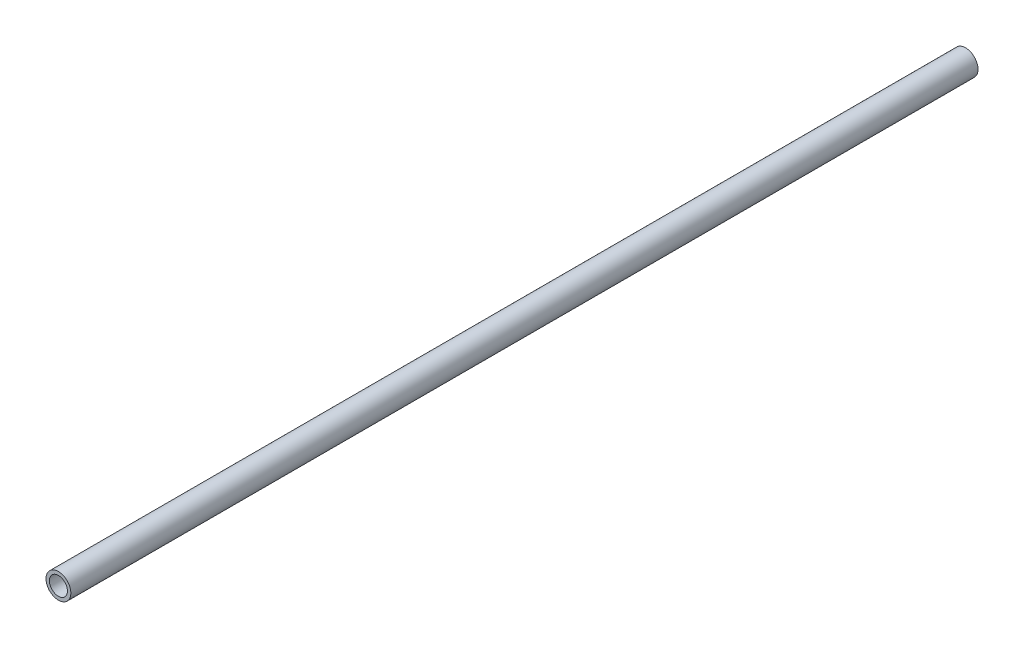
from build123d import *

# Parameters (mm, degrees)
SKETCH1_R           = 16.7005
SKETCH1_R_2         = 12.1539
EXTRUDE_THIN1_DEPTH = 609.6


with BuildPart() as part:
    # Sketch1 → Extrude-Thin1 (new, symmetric)
    with BuildSketch(Plane.XY):
        Circle(SKETCH1_R)
        Circle(SKETCH1_R_2, mode=Mode.SUBTRACT)
    extrude(amount=EXTRUDE_THIN1_DEPTH, both=True)


solid = part.part
